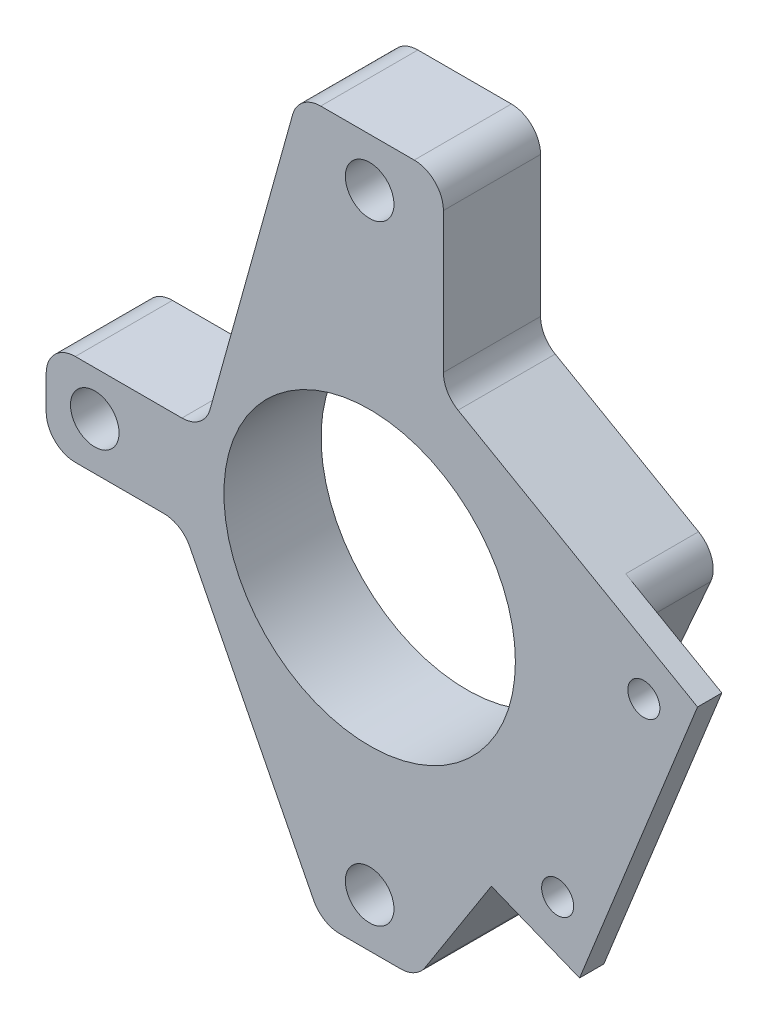
from build123d import *

# Parameters (mm, degrees)
SKETCH1_R           = 38.1
SKETCH1_R_2         = 6.35
BOSS_EXTRUDE1_DEPTH = 25.4
CUT_EXTRUDE1_DEPTH  = 19.05
SKETCH3_R           = 4.191
CUT_EXTRUDE2_DEPTH  = 135.408969451
FILLET1_R           = 7.62


with BuildPart() as part:
    # Sketch1 → Boss-Extrude1 (new body)
    with BuildSketch(Plane.XY):
        Polygon((-18.576252895, 100.365223368), (19.281255226, 100.365223368), (19.281255226, 51.662487547), (85.717168685, 13.57632424), (54.880053148, -63.203130515), (31.826573213, -53.944106385), (12.245486317, -84.531234699), (-12.530801949, -84.531234699), (-49.113541671, -12.382140744), (-84.5631354, -12.382140744), (-84.5631354, 11.598068918), (-43.284636092, 11.598068918), align=None)
        Circle(SKETCH1_R, mode=Mode.SUBTRACT)
        with Locations((0, 87.665223368)):
            Circle(SKETCH1_R_2, mode=Mode.SUBTRACT)
        with Locations((0, -71.831234699)):
            Circle(SKETCH1_R_2, mode=Mode.SUBTRACT)
        with Locations((-71.8631354, 0)):
            Circle(SKETCH1_R_2, mode=Mode.SUBTRACT)
    extrude(amount=BOSS_EXTRUDE1_DEPTH)

    # Sketch2 → Cut-Extrude1 (cut)
    with BuildSketch(Plane.XY):
        Polygon((54.880053148, -63.203130515), (85.717168685, 13.57632424), (66.538177491, 24.571193621), (31.826573213, -53.944106385), align=None)
    extrude(amount=CUT_EXTRUDE1_DEPTH, mode=Mode.SUBTRACT)

    # Sketch3 → Cut-Extrude2 (cut, through all)
    with BuildSketch(Plane.XY.offset(25.4)):
        with Locations((71.679164996, 8.361848351)):
            Circle(SKETCH3_R)
        with Locations((49.148937242, -47.734792738)):
            Circle(SKETCH3_R)
    extrude(amount=-CUT_EXTRUDE2_DEPTH, mode=Mode.SUBTRACT)

    # Fillet1
    fillet1_edges = [part.edges().sort_by_distance(p)[0] for p in [
        (-18.576252895, 100.365223368, 12.7),
        (19.281255226, 100.365223368, 12.7),
        (19.281255226, 51.662487547, 12.7),
        (66.538177491, 24.571193621, 9.525),
        (-49.113541671, -12.382140744, 12.7),
        (-84.5631354, -12.382140744, 12.7),
        (-84.5631354, 11.598068918, 12.7),
        (-43.284636092, 11.598068918, 12.7),
        (12.245486317, -84.531234699, 12.7),
        (-12.530801949, -84.531234699, 12.7),
    ]]
    fillet(fillet1_edges, radius=FILLET1_R)


solid = part.part
